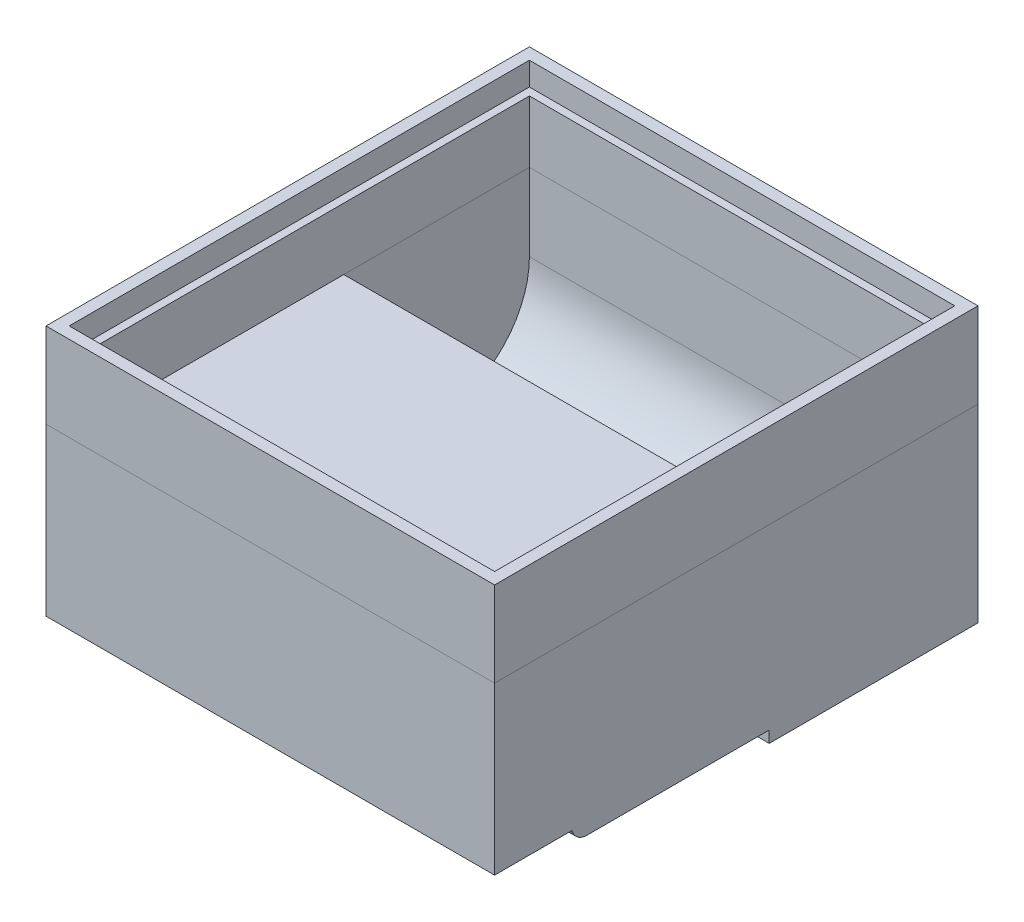
from build123d import *
from build123d.topology import SkipClean

# Parameters (mm, degrees)
SKETCH1_W                 = 58
SKETCH1_H                 = 62.5
BOSS_EXTRUDE1_DEPTH       = 35.5
SKETCH2_W                 = 55
SKETCH2_H                 = 59.5
CUT_EXTRUDE1_DEPTH        = 3
SKETCH3_W                 = 53
SKETCH3_H                 = 57.5
CUT_EXTRUDE2_DEPTH        = 8
SKETCH4_W                 = 53
SKETCH4_H                 = 24.5
CUT_EXTRUDE3_DEPTH        = 22
SKETCH5_W                 = 53
SKETCH5_H                 = 30.5
CUT_EXTRUDE4_DEPTH        = 22
BOSS_EXTRUDE2_REACH       = 57.478
SKETCH6_R                 = 3.5
SKETCH6_R_2               = 1.5
SKETCH6_2_R               = 1.5
CUT_EXTRUDE5_DEPTH        = 22
BOSS_EXTRUDE4_DEPTH       = 53
SKETCH8_W                 = 58
SKETCH8_H                 = 35.5
CUT_EXTRUDE6_DEPTH        = 1.5
SKETCH10_W                = 9.998360964
SKETCH10_H                = 5
CUT_EXTRUDE8_DEPTH        = 4
CUT_EXTRUDE7_REACH        = 58.482
CUT_EXTRUDE7_END_RADIUS   = 12
SKETCH9_W                 = 1.5
SKETCH9_H                 = 2.5
SKETCH11_W                = 55
SKETCH11_H                = 32.5
CUT_EXTRUDE9_DEPTH        = 1.5
SKETCH12_W                = 58
SKETCH12_H                = 10
CUT_EXTRUDE10_DEPTH       = 1.5
FILLET2_R                 = 2
ADVANCEDHOLE1_OUTLINE_R   = 2.75
ADVANCEDHOLE1_DEPTH       = 2.45
ADVANCEDHOLE1_DRAFT       = 45
ADVANCEDHOLE1_2_OUTLINE_R = 2.75
ADVANCEDHOLE1_2_DEPTH     = 2.45
ADVANCEDHOLE1_2_DRAFT     = 45
SKETCH13_R                = 2.5
CUT_EXTRUDE11_DEPTH       = 56.478036195
SPLIT1_START              = -31.25
SPLIT1_OUTLINE_W          = 58
SPLIT1_OUTLINE_H          = 11
SPLIT1_DEPTH              = 62.5
SPLIT1_2_DEPTH            = 62.5
SPLIT1_3_OUTLINE_W        = 53
SPLIT1_3_OUTLINE_H        = 8
SPLIT1_3_DEPTH            = 2.5
SPLIT1_START_2            = 28.75
SPLIT1_4_OUTLINE_W        = 53
SPLIT1_4_OUTLINE_H        = 8
SPLIT1_4_DEPTH            = 2.5
SPLIT1_5_OUTLINE_W        = 55
SPLIT1_5_OUTLINE_H        = 3
SPLIT1_5_DEPTH            = 1.5
SPLIT1_START_3            = 29.75
SPLIT1_6_OUTLINE_W        = 55
SPLIT1_6_OUTLINE_H        = 3
SPLIT1_6_DEPTH            = 1.5


# Read off the part's stored shape, not the designer's step: AdvancedHole1, Split1
with BuildPart() as part:
    # Sketch1 → Boss-Extrude1 (new body)
    with BuildSketch(Plane(origin=(0, 0, 0), x_dir=(1, 0, 0), z_dir=(0, 1, 0))):
        Rectangle(SKETCH1_W, SKETCH1_H)
    extrude(amount=-BOSS_EXTRUDE1_DEPTH)

    # Sketch2 → Cut-Extrude1 (cut)
    with BuildSketch(Plane(origin=(0, 0, 0), x_dir=(1, 0, 0), z_dir=(0, 1, 0))):
        Rectangle(SKETCH2_W, SKETCH2_H)
    extrude(amount=-CUT_EXTRUDE1_DEPTH, mode=Mode.SUBTRACT)

    # Sketch3 → Cut-Extrude2 (cut)
    with BuildSketch(Plane(origin=(0, -3, 0), x_dir=(1, 0, 0), z_dir=(0, 1, 0))):
        Rectangle(SKETCH3_W, SKETCH3_H)
    extrude(amount=-CUT_EXTRUDE2_DEPTH, mode=Mode.SUBTRACT)

    # Sketch4 → Cut-Extrude3 (cut)
    with BuildSketch(Plane(origin=(0, -11, 0), x_dir=(1, 0, 0), z_dir=(0, 1, 0))):
        with Locations((0, 16.5)):
            Rectangle(SKETCH4_W, SKETCH4_H)
    extrude(amount=-CUT_EXTRUDE3_DEPTH, mode=Mode.SUBTRACT)

    # Sketch5 → Cut-Extrude4 (cut)
    with BuildSketch(Plane.XZ.offset(35.5)):
        with Locations((0, 13.5)):
            Rectangle(SKETCH5_W, SKETCH5_H)
    extrude(amount=-CUT_EXTRUDE4_DEPTH, mode=Mode.SUBTRACT)

    # Sketch6 → Boss-Extrude2 (add, up to next)
    with BuildSketch(Plane.XZ.offset(35.5), mode=Mode.PRIVATE) as boss_extrude2_sk1:
        with Locations((-25.5, 27.75)):
            Circle(SKETCH6_R)
        with Locations((-25.5, 27.75)):
            Circle(SKETCH6_R_2, mode=Mode.SUBTRACT)
    boss_extrude2_tool1 = extrude(boss_extrude2_sk1.sketch, amount=-BOSS_EXTRUDE2_REACH, mode=Mode.PRIVATE) - part.part
    # Sketch6 → Boss-Extrude2 (add, up to next)
    with BuildSketch(Plane.XZ.offset(35.5), mode=Mode.PRIVATE) as boss_extrude2_sk2:
        with Locations((25.5, 27.75)):
            Circle(SKETCH6_R)
        with Locations((25.5, 27.75)):
            Circle(SKETCH6_R_2, mode=Mode.SUBTRACT)
    boss_extrude2_tool2 = extrude(boss_extrude2_sk2.sketch, amount=-BOSS_EXTRUDE2_REACH, mode=Mode.PRIVATE) - part.part
    add(boss_extrude2_tool1.solids().sort_by_distance((-28.901005, -35.5, 27.75))[0])
    add(boss_extrude2_tool2.solids().sort_by_distance((22.098995, -35.5, 27.75))[0])

    # Sketch6<2> → Cut-Extrude5 (cut)
    with BuildSketch(Plane.XZ.offset(35.5)):
        with Locations(Location((-25.5, 27.75, 0), (0, 0, 270))):
            Circle(SKETCH6_2_R)
        with Locations(Location((25.5, 27.75, 0), (0, 0, 90))):
            Circle(SKETCH6_2_R)
    extrude(amount=-CUT_EXTRUDE5_DEPTH, mode=Mode.SUBTRACT)

    # Sketch7 → Boss-Extrude4 (add)
    with BuildSketch(Plane.ZY.offset(-26.5)):
        with BuildLine():
            Line((-16.75, -33), (-4.25, -33))
            Line((-4.25, -33), (-4.25, -11))
            Line((-4.25, -11), (-4.75, -11))
            Line((-4.75, -11), (-4.75, -21))
            ThreePointArc((-4.75, -21), (-8.264718626, -29.485281374), (-16.75, -33))
        make_face()
        with BuildLine():
            Line((-28.75, -33), (-16.75, -33))
            ThreePointArc((-16.75, -33), (-25.235281374, -29.485281374), (-28.75, -21))
            Line((-28.75, -21), (-28.75, -33))
        make_face()
    extrude(amount=BOSS_EXTRUDE4_DEPTH)

    # Sketch8 → Cut-Extrude6 (cut)
    with BuildSketch(Plane.XZ.offset(35.5)):
        with Locations((0, 13.5)):
            Rectangle(SKETCH8_W, SKETCH8_H)
    extrude(amount=-CUT_EXTRUDE6_DEPTH, mode=Mode.SUBTRACT)

    # Sketch10 → Cut-Extrude8 (cut)
    with BuildSketch(Plane.XZ.offset(34)):
        with Locations((0, -4.25)):
            Rectangle(SKETCH10_W, SKETCH10_H)
    extrude(amount=-CUT_EXTRUDE8_DEPTH, mode=Mode.SUBTRACT)

    # Cut-Extrude7: up to this cylinder (the profile starts outside it)
    cut_extrude7_end = Plane(origin=(-25.75, -21, -16.75), z_dir=(1, 0, 0)) * Cylinder(CUT_EXTRUDE7_END_RADIUS, 141.964, mode=Mode.PRIVATE)
    # Sketch9 → Cut-Extrude7 (cut, up to the surface)
    with BuildSketch(Plane.XY.offset(-1.75), mode=Mode.PRIVATE) as cut_extrude7_sk1:
        with Locations((-25.75, -23.75)):
            Rectangle(SKETCH9_W, SKETCH9_H)
    cut_extrude7_tool1 = extrude(cut_extrude7_sk1.sketch, amount=-CUT_EXTRUDE7_REACH, mode=Mode.PRIVATE) - cut_extrude7_end
    add(cut_extrude7_tool1.solids().sort_by_distance((-25.75, -23.75, -1.75))[0], mode=Mode.SUBTRACT)

    # Sketch11 → Cut-Extrude9 (cut)
    with BuildSketch(Plane.XZ.offset(34)):
        with Locations((0, 13.5)):
            Rectangle(SKETCH11_W, SKETCH11_H)
    extrude(amount=-CUT_EXTRUDE9_DEPTH, mode=Mode.SUBTRACT)

    # Sketch12 → Cut-Extrude10 (cut)
    with BuildSketch(Plane.XZ.offset(34)):
        with Locations((0, 26.25)):
            Rectangle(SKETCH12_W, SKETCH12_H)
    extrude(amount=-CUT_EXTRUDE10_DEPTH, mode=Mode.SUBTRACT)

    # Fillet2
    # the kernel refuses this fillet: 2 mm, written as the material it takes off along each edge
    with BuildSketch(Plane(origin=(-22.658770817, -34, 21.25), x_dir=(0, 0, -1), z_dir=(-1, 0, 0))) as fillet2_piece_1:
        with BuildLine():
            CenterArc((1.936491673, -2), FILLET2_R, 90, 75.522487814)
            Line((0, -1.5), (-0.038729833, -1.49))
            ThreePointArc((-0.038729833, -1.49), (-0.04, -0.75), (-0.04, 0))
            Line((-0.04, 0), (0, 0.04))
            Line((0, 0.04), (1.936491673, 0.04))
            Line((1.936491673, 0.04), (1.936491673, 0))
        make_face()
    extrude(amount=11.182458366, mode=Mode.SUBTRACT)
    with BuildSketch(Plane(origin=(33.841229183, -34, 21.25), x_dir=(0, 1, 0), z_dir=(-1, 0, 0))) as fillet2_piece_2:
        with BuildLine():
            CenterArc((2, 1.936491673), FILLET2_R, 180, 75.522487814)
            Line((0, 1.936491673), (-0.04, 1.936491673))
            Line((-0.04, 1.936491673), (-0.04, 0))
            Line((-0.04, 0), (0, -0.04))
            ThreePointArc((0, -0.04), (0.75, -0.04), (1.49, -0.038729833))
            Line((1.49, -0.038729833), (1.5, 0))
        make_face()
    extrude(amount=11.182458366, mode=Mode.SUBTRACT)


with BuildPart() as advancedhole1_tool:
    # AdvancedHole1 outline → AdvancedHole1 (with draft: the straight prism first)
    with BuildSketch(Plane(origin=(0, -33.05, 0), x_dir=(1, 0, 0), z_dir=(0, 1, 0))):
        with Locations((15, 16.25)):
            Circle(ADVANCEDHOLE1_OUTLINE_R)
    extrude(amount=-ADVANCEDHOLE1_DEPTH)
    # AdvancedHole1: the draft: its side faces are tilted about the plane it starts from
    advancedhole1_sides = [advancedhole1_tool.faces().sort_by_distance(p)[0] for p in [
        (12.25, -34.275, -16.25),
    ]]
    draft(advancedhole1_sides, Plane(origin=(0, -33.05, 0), x_dir=(1, 0, 0), z_dir=(0, 1, 0)), ADVANCEDHOLE1_DRAFT)


with BuildPart() as part_1:
    add(part.part)

    # AdvancedHole1: cut by advancedhole1_tool
    add(advancedhole1_tool.part, mode=Mode.SUBTRACT)


with BuildPart() as advancedhole1_2_tool:
    # AdvancedHole1 2 outline → AdvancedHole1 2 (with draft: the straight prism first)
    with BuildSketch(Plane(origin=(0, -33.05, 0), x_dir=(1, 0, 0), z_dir=(0, 1, 0))):
        with Locations((-15, 16.25)):
            Circle(ADVANCEDHOLE1_2_OUTLINE_R)
    extrude(amount=-ADVANCEDHOLE1_2_DEPTH)
    # AdvancedHole1 2: the draft: its side faces are tilted about the plane it starts from
    advancedhole1_2_sides = [advancedhole1_2_tool.faces().sort_by_distance(p)[0] for p in [
        (-17.75, -34.275, -16.25),
    ]]
    draft(advancedhole1_2_sides, Plane(origin=(0, -33.05, 0), x_dir=(1, 0, 0), z_dir=(0, 1, 0)), ADVANCEDHOLE1_2_DRAFT)


with BuildPart() as part_2:
    add(part_1.part)

    # AdvancedHole1 2: cut by advancedhole1_2_tool
    add(advancedhole1_2_tool.part, mode=Mode.SUBTRACT)

    # Sketch13 → Cut-Extrude11 (cut, through all)
    with SkipClean():  # the faces are left unmerged after this step: merging them gives an invalid solid
        with BuildSketch(Plane.XZ.offset(35.5)):
            with Locations(Location((15, -16.25, 0), (0, 0, 270))):
                Circle(SKETCH13_R)
            with Locations(Location((-15, -16.25, 0), (0, 0, 270))):
                Circle(SKETCH13_R)
        extrude(amount=-CUT_EXTRUDE11_DEPTH, mode=Mode.SUBTRACT)

    # Split1 outline → Split1 (cut)
    with SkipClean():  # the faces are left unmerged after this step: merging them gives an invalid solid
        with BuildSketch(Plane.XY.offset(SPLIT1_START)):
            with Locations((0, -5.5)):
                Rectangle(SPLIT1_OUTLINE_W, SPLIT1_OUTLINE_H)
        extrude(amount=SPLIT1_DEPTH, mode=Mode.SUBTRACT)


with BuildPart() as body_2:
    # Split1 2 outline → Split1 2 (new body)
    with BuildSketch(Plane.XY.offset(SPLIT1_START)):
        Polygon((26.5, -11), (29, -11), (29, 0), (27.5, 0), (27.5, -3), (26.5, -3), align=None)
        Polygon((-29, -11), (-26.5, -11), (-26.5, -3), (-27.5, -3), (-27.5, 0), (-29, 0), align=None)
    extrude(amount=SPLIT1_2_DEPTH)

    # Split1 3 outline → Split1 3 (add)
    with BuildSketch(Plane.XY.offset(SPLIT1_START)):
        with Locations((0, -7)):
            Rectangle(SPLIT1_3_OUTLINE_W, SPLIT1_3_OUTLINE_H)
    extrude(amount=SPLIT1_3_DEPTH)

    # Split1 4 outline → Split1 4 (add)
    with BuildSketch(Plane.XY.offset(SPLIT1_START_2)):
        with Locations((0, -7)):
            Rectangle(SPLIT1_4_OUTLINE_W, SPLIT1_4_OUTLINE_H)
    extrude(amount=SPLIT1_4_DEPTH)

    # Split1 5 outline → Split1 5 (add)
    with BuildSketch(Plane.XY.offset(SPLIT1_START)):
        with Locations((0, -1.5)):
            Rectangle(SPLIT1_5_OUTLINE_W, SPLIT1_5_OUTLINE_H)
    extrude(amount=SPLIT1_5_DEPTH)

    # Split1 6 outline → Split1 6 (add)
    with BuildSketch(Plane.XY.offset(SPLIT1_START_3)):
        with Locations((0, -1.5)):
            Rectangle(SPLIT1_6_OUTLINE_W, SPLIT1_6_OUTLINE_H)
    extrude(amount=SPLIT1_6_DEPTH)


solid = Compound([part_2.part, body_2.part])
